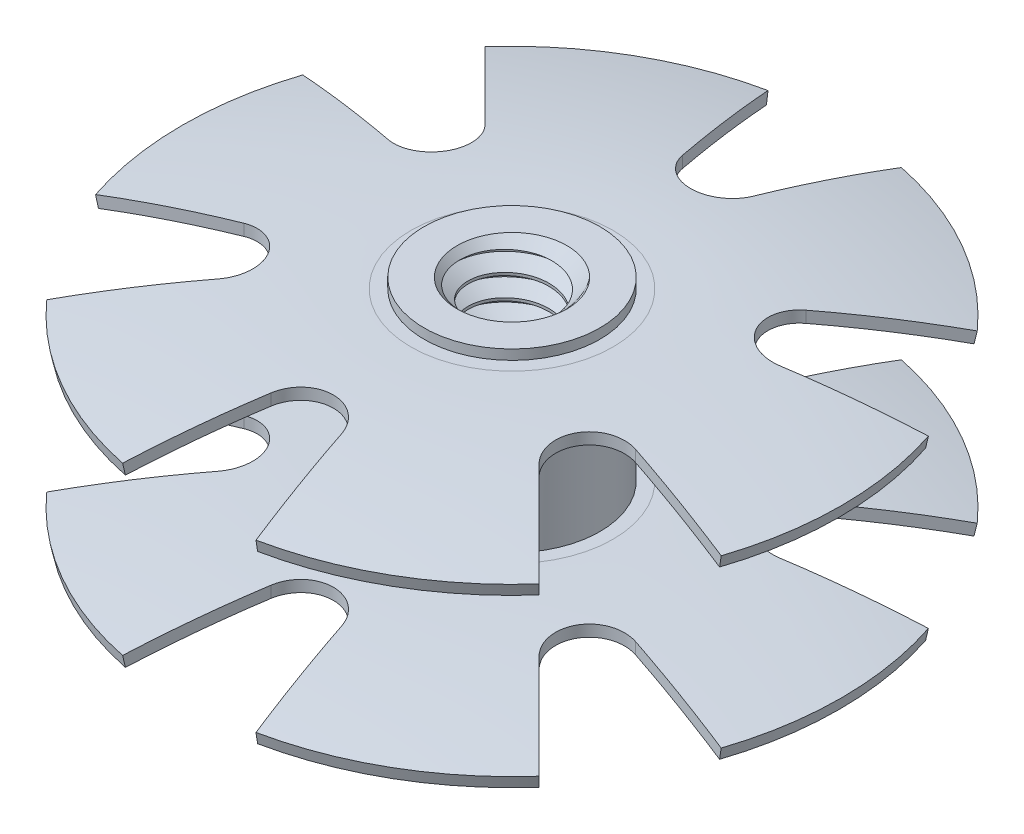
from build123d import *

# Parameters (mm, degrees)
CUT_EXTRUDE5_DEPTH = 30.565864752
CIRPATTERN1_COUNT  = 6
SWEEP1_PITCH       = 1.27
SKETCH4_R          = 5.08
CUT_EXTRUDE1_DEPTH = 31.401531868
SKETCH5_R          = 5.08
CUT_EXTRUDE2_DEPTH = 30.010118148


with BuildPart() as part:
    # Sketch1 → Revolve1 (revolve)
    with BuildSketch(Plane.XY, mode=Mode.PRIVATE) as revolve1_sk:
        Polygon((-5.08, 5.715), (-3.175, 5.715), (-3.175, -5.715), (-5.08, -5.715), (-5.08, -5.1435), (-4.572, -5.1435), (-4.572, -4.4831), (-5.08, -4.4831), (-5.08, 4.4831), (-4.572, 4.4831), (-4.572, 5.1435), (-5.08, 5.1435), align=None)
    revolve(revolve1_sk.sketch.rotate(Axis((0, 0, 0), (0, 1, 0)), 270), axis=Axis((0, 0, 0), (0, 1, 0)))

    # Sketch8 → Revolve2 (revolve)
    with BuildSketch(Plane.XY, mode=Mode.PRIVATE) as revolve2_sk:
        with BuildLine():
            Line((-5.842, 5.1435), (-4.572, 5.1435))
            Line((-4.572, 5.1435), (-4.572, 4.4831))
            Line((-4.572, 4.4831), (-5.842, 4.4831))
            ThreePointArc((-5.842, 4.4831), (-12.413235592, 4.15206201), (-18.917933473, 3.1623))
            Line((-18.917933473, 3.1623), (-19.05, 3.809359961))
            ThreePointArc((-19.05, 3.809359961), (-12.47960487, 4.809118537), (-5.842, 5.1435))
        make_face()
        with BuildLine():
            Line((-5.842, -4.4831), (-4.572, -4.4831))
            Line((-4.572, -4.4831), (-4.572, -5.1435))
            Line((-4.572, -5.1435), (-5.842, -5.1435))
            ThreePointArc((-5.842, -5.1435), (-12.413235592, -5.47453799), (-18.917933473, -6.4643))
            Line((-18.917933473, -6.4643), (-19.05, -5.817240039))
            ThreePointArc((-19.05, -5.817240039), (-12.47960487, -4.817481463), (-5.842, -4.4831))
        make_face()
    revolve(revolve2_sk.sketch.rotate(Axis((0, 0, 0), (0, 1, 0)), 270), axis=Axis((0, 0, 0), (0, 1, 0)))

    # Sketch9 → Cut-Extrude5 (cut, through all)
    with BuildSketch(Plane(origin=(0, 5.715, 0), x_dir=(1, 0, 0), z_dir=(0, 1, 0))):
        with BuildLine():
            Line((-2.044542999, 11.898166355), (-3.855250299, 18.655817997))
            ThreePointArc((-3.855250299, 18.655817997), (0, 19.05), (3.855250299, 18.655817997))
            Line((3.855250299, 18.655817997), (2.044542999, 11.898166355))
            ThreePointArc((2.044542999, 11.898166355), (0, 10.329333333), (-2.044542999, 11.898166355))
        make_face()
    cut_extrude5 = extrude(amount=-CUT_EXTRUDE5_DEPTH, mode=Mode.SUBTRACT)

    # CirPattern1: Cut-Extrude5 ×6 about axis
    cirpattern1_axis = Axis((0, 0, 0), (0, 1, 0))
    for i in range(1, CIRPATTERN1_COUNT):
        add(cut_extrude5.rotate(cirpattern1_axis, i * 360 / CIRPATTERN1_COUNT), mode=Mode.SUBTRACT)

    # Sweep1: the profile of Sketch3 profile screwed along a right-hand helix of 11.5 turns, 6 arcs to a turn; built about Z, then put on its axis
    sweep1_z = Axis((0, 0, 0), (0, 0, 1))
    sweep1_corners = [(2.350110803, 0, -0.635), (2.350110803, 0, -0.47625), (3.1753, 0, 0.000173205), (3.1753, 0, -1.111423205)]
    with BuildLine(mode=Mode.PRIVATE) as sweep1_profile:
        Line(sweep1_corners[0], sweep1_corners[1])
        Line(sweep1_corners[1], sweep1_corners[2])
        Line(sweep1_corners[2], sweep1_corners[3])
        Line(sweep1_corners[3], sweep1_corners[0])
    sweep1_cap = Face(sweep1_profile.wire())
    sweep1_turn_angles = [0, 30, 60, 90, 120, 150, 180, 210, 240, 270, 300, 330, 360]
    sweep1_turn_weights = [1, 0.8660254037844387, 1, 0.8660254037844387, 1, 0.8660254037844387, 1, 0.8660254037844387, 1, 0.8660254037844387, 1, 0.8660254037844387, 1]
    sweep1_turn_rails = [Edge.make_bspline([Vector(p[0], p[1], 0).rotate(sweep1_z, sweep1_turn_angles[k]) / sweep1_turn_weights[k] + Vector(0, 0, p[2] + SWEEP1_PITCH * sweep1_turn_angles[k] / 360) for k in range(13)], [0, 0, 0, 1, 1, 2, 2, 3, 3, 4, 4, 5, 5, 6, 6, 6], 2, sweep1_turn_weights) for p in sweep1_corners]
    sweep1_turn_sides = [Face.make_surface_from_curves(sweep1_turn_rails[p[0]], sweep1_turn_rails[p[1]]) for p in [(0, 1), (1, 2), (2, 3), (3, 0)]]
    sweep1_last_angles = [3960, 3990, 4020, 4050, 4080, 4110, 4140]
    sweep1_last_weights = [1, 0.8660254037844387, 1, 0.8660254037844387, 1, 0.8660254037844743, 1]
    sweep1_last_rails = [Edge.make_bspline([Vector(p[0], p[1], 0).rotate(sweep1_z, sweep1_last_angles[k]) / sweep1_last_weights[k] + Vector(0, 0, p[2] + SWEEP1_PITCH * sweep1_last_angles[k] / 360) for k in range(7)], [0, 0, 0, 1, 1, 2, 2, 3, 3, 3], 2, sweep1_last_weights) for p in sweep1_corners]
    sweep1_last_sides = [Face.make_surface_from_curves(sweep1_last_rails[p[0]], sweep1_last_rails[p[1]]) for p in [(0, 1), (1, 2), (2, 3), (3, 0)]]
    sweep1 = Plane(origin=(0, 5.715, 0), x_dir=(1, 0, 0), z_dir=(0, -1, 0)) * Solid(Shell([*[p.moved(Location((0, 0, SWEEP1_PITCH * i))) for i in range(11) for p in sweep1_turn_sides], *sweep1_last_sides, sweep1_cap, sweep1_cap.rotate(sweep1_z, 4140).moved(Location((0, 0, SWEEP1_PITCH * 4140 / 360)))]))
    add(sweep1)

    # Sketch4 → Cut-Extrude1 (cut, through all)
    with BuildSketch(Plane(origin=(0, 5.715, 0), x_dir=(1, 0, 0), z_dir=(0, 1, 0))):
        with Locations(Location((0, 0, 0), (0, 0, 90))):
            Circle(SKETCH4_R)
    extrude(amount=CUT_EXTRUDE1_DEPTH, mode=Mode.SUBTRACT)

    # Sketch5 → Cut-Extrude2 (cut, through all)
    with BuildSketch(Plane.XZ.offset(5.715)):
        with Locations(Location((0, 0, 0), (0, 0, 270))):
            Circle(SKETCH5_R)
    extrude(amount=CUT_EXTRUDE2_DEPTH, mode=Mode.SUBTRACT)

    # Cut-Extrude3 cone 1 section (through the dimple's axis) → Cut-Extrude3 (revolve, cut)
    with BuildSketch(Plane(origin=(0, -5.715, 0), x_dir=(0, 0, -1), z_dir=(1, 0, 0))):
        Polygon((0, 0), (3.175, 0), (0, 3.175), align=None)
    revolve(axis=Axis((0, -5.715, 0), (0, 1, 0)), mode=Mode.SUBTRACT)

    # Cut-Extrude4 cone 1 section (through the dimple's axis) → Cut-Extrude4 (revolve, cut)
    with BuildSketch(Plane(origin=(0, 5.715, 0), x_dir=(0, 0, 1), z_dir=(1, 0, 0))):
        Polygon((0, 0), (3.175, 0), (0, 3.175), align=None)
    revolve(axis=Axis((0, 5.715, 0), (0, -1, 0)), mode=Mode.SUBTRACT)


solid = part.part
